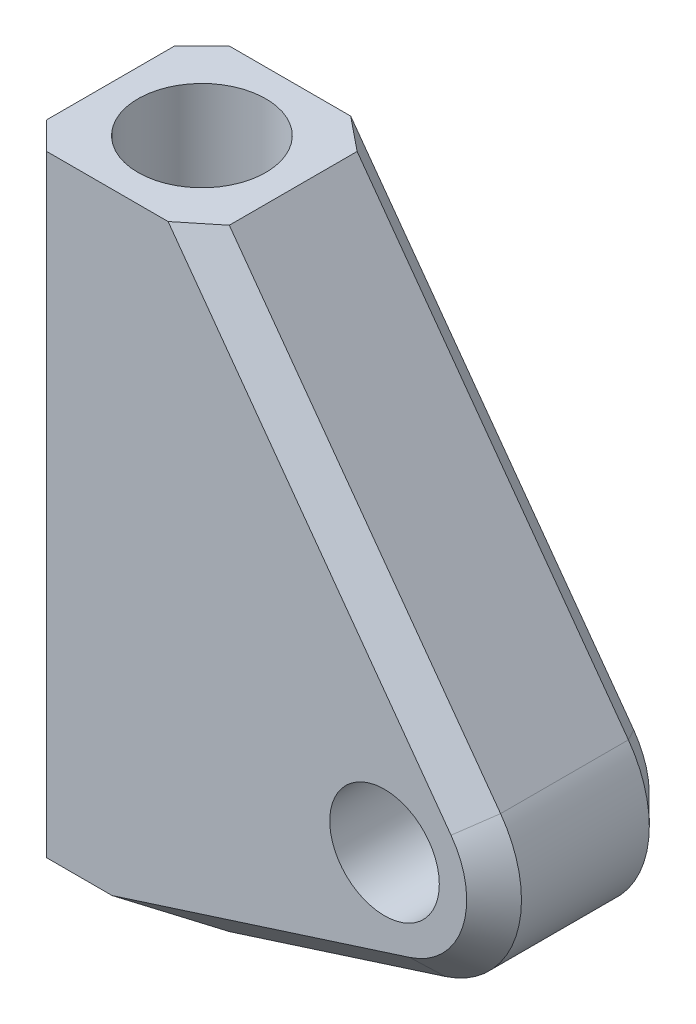
from build123d import *

# Parameters (mm, degrees)
SZKIC1_R                    = 6
DODANIE_WYCI_GNI_CIE1_DEPTH = 20
SZKIC2_R                    = 7
WYTNIJ_WYCI_GNI_CIE1_DEPTH  = 88.137821869
SFAZOWANIE1_SIZE            = 3


with BuildPart() as part:
    # Szkic1 → Dodanie-wyciągnięcie1 (new body)
    with BuildSketch(Plane.XY):
        with BuildLine():
            Line((0, 0), (0, 67))
            Line((0, 67), (20, 67))
            Line((20, 67), (49.71285167, 26.047021529))
            ThreePointArc((49.71285167, 26.047021529), (51.40319706, 15.262742073), (43.657559147, 7.570990372))
            Line((43.657559147, 7.570990372), (20, 0))
            Line((20, 0), (0, 0))
        make_face()
        with Locations((40, 19)):
            Circle(SZKIC1_R, mode=Mode.SUBTRACT)
    extrude(amount=DODANIE_WYCI_GNI_CIE1_DEPTH)

    # Szkic2 → Wytnij-wyciągnięcie1 (cut, through all)
    with BuildSketch(Plane(origin=(0, 67, 0), x_dir=(1, 0, 0), z_dir=(0, 1, 0))):
        with Locations((10, -10)):
            Circle(SZKIC2_R)
    extrude(amount=-WYTNIJ_WYCI_GNI_CIE1_DEPTH, mode=Mode.SUBTRACT)

    # Sfazowanie1
    sfazowanie1_edges = [part.edges().sort_by_distance(p)[0] for p in [
        (0, 33.5, 0),
        (0, 33.5, 20),
        (31.828779573, 3.785495186, 20),
        (51.40319706, 15.262742073, 20),
        (34.856425835, 46.523510765, 20),
        (31.828779573, 3.785495186, 0),
        (51.40319706, 15.262742073, 0),
        (34.856425835, 46.523510765, 0),
    ]]
    chamfer(sfazowanie1_edges, length=SFAZOWANIE1_SIZE)


solid = part.part
